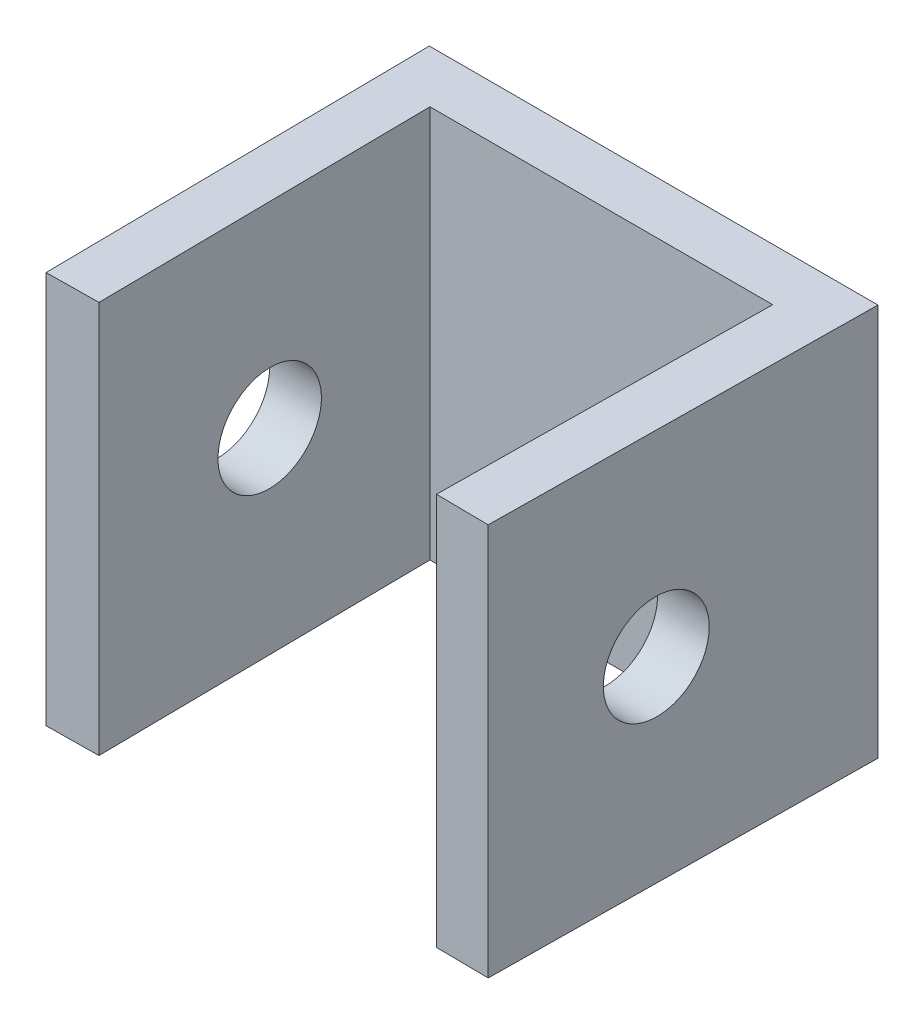
from build123d import *

# Parameters (mm, degrees)
BOSS_EXTRUDE1_DEPTH      = 30
SKETCH3_R                = 4
CUT_EXTRUDE1_DEPTH       = 40
SKETCH4_W                = 3
SKETCH4_H                = 41
BOSS_EXTRUDE2_DEPTH      = 4
BOSS_EXTRUDE3_DEPTH      = 25
BOSS_EXTRUDE3_DEPTH_BACK = 4
SKETCH5_W                = 3
SKETCH5_H                = 7.75
BOSS_EXTRUDE4_REACH      = 69.734
SKETCH6_W                = 4
SKETCH6_H                = 56.5
CUT_EXTRUDE2_DEPTH       = 62


with BuildPart() as part:
    # Sketch1 → Boss-Extrude1 (new body)
    with BuildSketch(Plane(origin=(0, 0, 0), x_dir=(1, 0, 0), z_dir=(0, 1, 0))):
        Polygon((-12.8, -12.8), (-13.1, 12.8), (13.1, 12.8), (12.8, -12.6), (16.799721029, -12.6472408), (17.147523085, 16.8), (-17.147149649, 16.8), (-16.79972537, -12.846871782), align=None)
    extrude(amount=BOSS_EXTRUDE1_DEPTH)

    # Sketch3 → Cut-Extrude1 (cut)
    with BuildSketch(Plane(origin=(16.946733814, 0, 0.200158273), x_dir=(0.011810199887684227, 0, -0.9999302571572745), z_dir=(0.9999302571572745, 0, 0.011810199887684227))):
        with Locations((0.252049318, 15)):
            Circle(SKETCH3_R)
    extrude(amount=-CUT_EXTRUDE1_DEPTH, mode=Mode.SUBTRACT)

    # Sketch4 → Boss-Extrude2 (add)
    with BuildSketch(Plane(origin=(0, 0, -16.8), x_dir=(-1, 0, 0), z_dir=(0, 0, -1))):
        with Locations((12.499813282, 15)):
            Rectangle(SKETCH4_W, SKETCH4_H)
    extrude(amount=-BOSS_EXTRUDE2_DEPTH)

    # Sketch5 → Boss-Extrude3 (add, two sides: drawn at the far end of the back side and taken through both)
    with BuildSketch(Plane(origin=(0, 0, -16.8), x_dir=(-1, 0, 0), z_dir=(0, 0, -1)).offset(-BOSS_EXTRUDE3_DEPTH_BACK)):
        with Locations((12.499813282, 39.375)):
            Rectangle(SKETCH5_W, SKETCH5_H)
        with Locations((12.499813282, -9.375)):
            Rectangle(SKETCH5_W, SKETCH5_H)
    extrude(amount=BOSS_EXTRUDE3_DEPTH + BOSS_EXTRUDE3_DEPTH_BACK)

    # Boss-Extrude4: up to this plane
    boss_extrude4_end = Plane(origin=(-16.79972537, 30, 12.846871782), z_dir=(0.9999313425206403, 0, -0.01171794542016394))
    # Sketch6 → Boss-Extrude4 (add, up to the surface)
    with BuildSketch(Plane.ZY.offset(13.999813282), mode=Mode.PRIVATE) as boss_extrude4_sk1:
        with Locations((-14.8, 15)):
            Rectangle(SKETCH6_W, SKETCH6_H)
    boss_extrude4_tool1 = split(extrude(boss_extrude4_sk1.sketch, amount=BOSS_EXTRUDE4_REACH, mode=Mode.PRIVATE), bisect_by=boss_extrude4_end, keep=Keep.BOTH, mode=Mode.PRIVATE)
    add(boss_extrude4_tool1.solids().sort_by_distance((-13.999813, 15, -14.8))[0])

    # Sketch7 → Cut-Extrude2 (cut)
    with BuildSketch(Plane(origin=(-16.947947202, 0, 0.198608756), x_dir=(0.01171794542016394, 0, 0.9999313425206403), z_dir=(-0.9999313425206403, 0, 0.01171794542016394))):
        Polygon((12.649131483, 30), (-40.255802642, 30), (-53.566220107, 38.891145172), (-52.192714639, 50.02792354), (-13.80333558, 48.779139174), (23.506142402, 46.053591691), (14.671560105, 30), align=None)
        Polygon((12.649131483, 0), (-49.960950266, 0), (-43.210741963, -24.331655391), (11.653429031, -25.806337238), (35.291011187, -15.934393486), (29.689158759, -2.52120452), align=None)
    extrude(amount=-CUT_EXTRUDE2_DEPTH, mode=Mode.SUBTRACT)


solid = part.part
